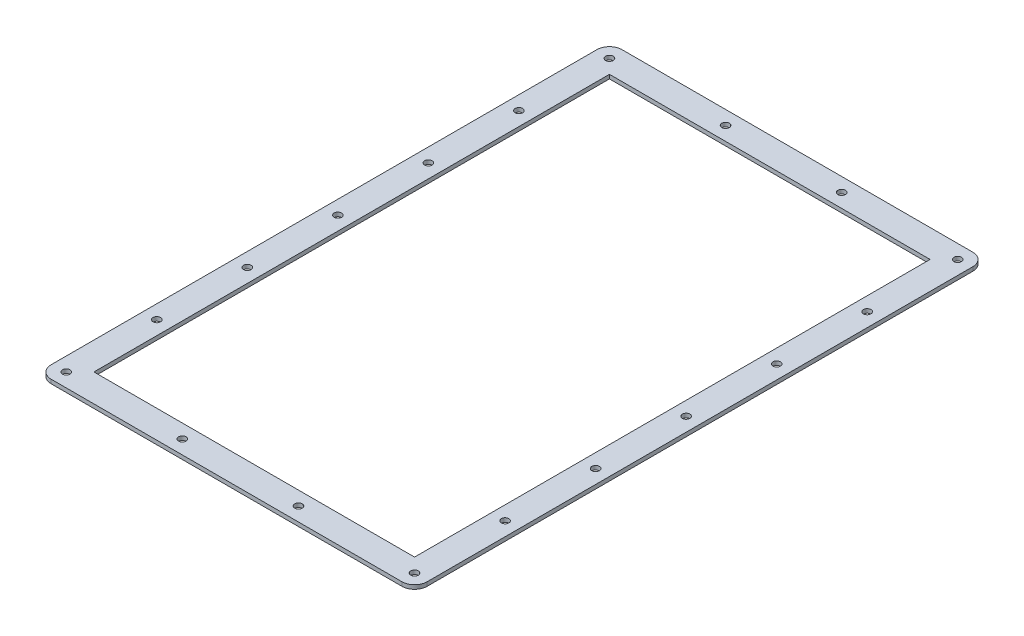
from build123d import *

# Parameters (mm, degrees)
SKETCH1_W           = 299
SKETCH1_H           = 454
SKETCH1_R           = 3
SKETCH1_W_2         = 255
SKETCH1_H_2         = 410
BOSS_EXTRUDE1_DEPTH = 3.175
FILLET1_R           = 10


with BuildPart() as part:
    # Sketch1 → Boss-Extrude1 (new body)
    with BuildSketch(Plane(origin=(0, 0, 0), x_dir=(1, 0, 0), z_dir=(0, 1, 0))):
        with Locations((2.5, -45)):
            Rectangle(SKETCH1_W, SKETCH1_H)
        with Locations((-136, -261)):
            Circle(SKETCH1_R, mode=Mode.SUBTRACT)
        with Locations((-136, -189)):
            Circle(SKETCH1_R, mode=Mode.SUBTRACT)
        with Locations((-43.666666667, -261)):
            Circle(SKETCH1_R, mode=Mode.SUBTRACT)
        with Locations((-136, -117)):
            Circle(SKETCH1_R, mode=Mode.SUBTRACT)
        with Locations((-136, -45)):
            Circle(SKETCH1_R, mode=Mode.SUBTRACT)
        with Locations((48.666666667, -261)):
            Circle(SKETCH1_R, mode=Mode.SUBTRACT)
        with Locations((141, -261)):
            Circle(SKETCH1_R, mode=Mode.SUBTRACT)
        with Locations((141, -189)):
            Circle(SKETCH1_R, mode=Mode.SUBTRACT)
        with Locations((141, -117)):
            Circle(SKETCH1_R, mode=Mode.SUBTRACT)
        with Locations((-136, 27)):
            Circle(SKETCH1_R, mode=Mode.SUBTRACT)
        with Locations((2.5, -45)):
            Rectangle(SKETCH1_W_2, SKETCH1_H_2, mode=Mode.SUBTRACT)
        with Locations((-136, 99)):
            Circle(SKETCH1_R, mode=Mode.SUBTRACT)
        with Locations((-136, 171)):
            Circle(SKETCH1_R, mode=Mode.SUBTRACT)
        with Locations((-43.666666667, 171)):
            Circle(SKETCH1_R, mode=Mode.SUBTRACT)
        with Locations((141, -45)):
            Circle(SKETCH1_R, mode=Mode.SUBTRACT)
        with Locations((141, 27)):
            Circle(SKETCH1_R, mode=Mode.SUBTRACT)
        with Locations((48.666666667, 171)):
            Circle(SKETCH1_R, mode=Mode.SUBTRACT)
        with Locations((141, 99)):
            Circle(SKETCH1_R, mode=Mode.SUBTRACT)
        with Locations((141, 171)):
            Circle(SKETCH1_R, mode=Mode.SUBTRACT)
    extrude(amount=BOSS_EXTRUDE1_DEPTH)

    # Fillet1
    fillet1_edges = [part.edges().sort_by_distance(p)[0] for p in [
        (152, 1.5875, 272),
        (-147, 1.5875, 272),
        (152, 1.5875, -182),
        (-147, 1.5875, -182),
    ]]
    fillet(fillet1_edges, radius=FILLET1_R)


solid = part.part
